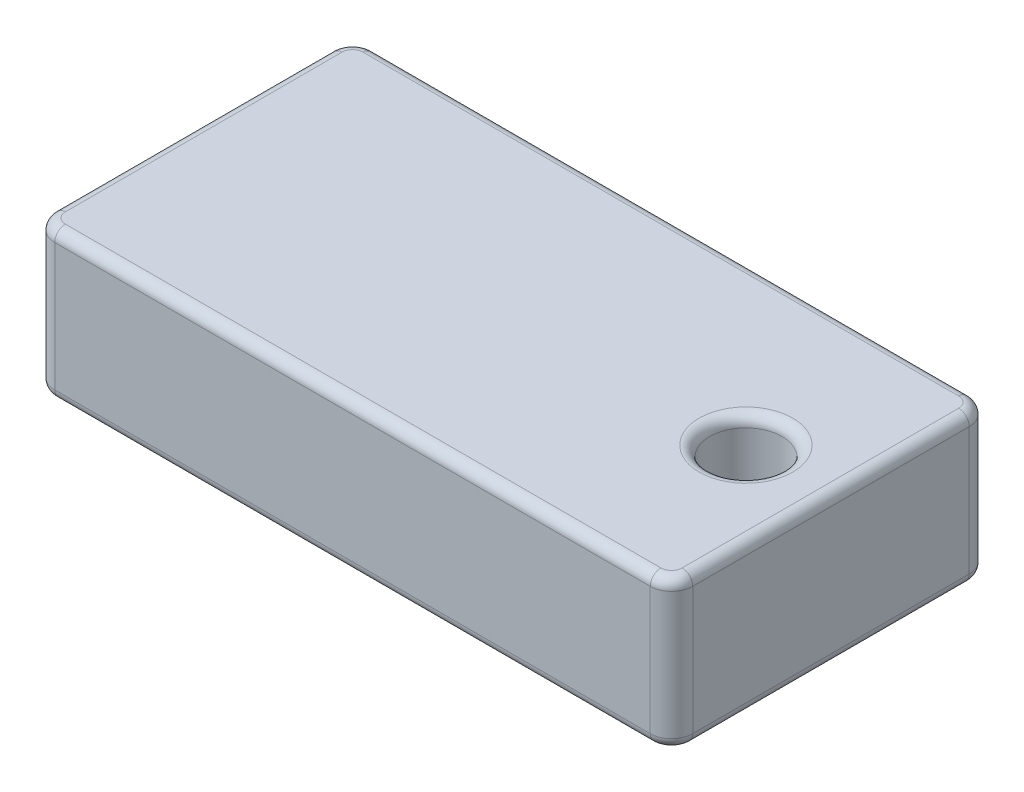
from build123d import *

# Parameters (mm, degrees)
SKETCH_1_W          = 30
SKETCH_1_H          = 15
EXTRUDE_1_DEPTH     = 7
HOLE_WIZARD_M3_1_D  = 3.4
FILLET_1_R          = 1
FILLET_2_R          = 0.5
SKETCH_4_W          = 4.766027623
SKETCH_4_H          = 0.404956595
CUT_EXTRUDE_1_DEPTH = 3


with BuildPart() as part:
    # 草图1 → 凸台-拉伸1 (new body)
    with BuildSketch(Plane(origin=(0, 0, 0), x_dir=(1, 0, 0), z_dir=(0, 1, 0))):
        Rectangle(SKETCH_1_W, SKETCH_1_H)
    extrude(amount=EXTRUDE_1_DEPTH)

    # M3 间隙孔1 (through all)
    with Locations(Plane(origin=(0, 7, 0), x_dir=(1, 0, 0), z_dir=(0, 1, 0))):
        with Locations((11, 0)):
            Hole(HOLE_WIZARD_M3_1_D / 2)

    # 圆角1
    fillet_1_edges = [part.edges().sort_by_distance(p)[0] for p in [
        (-15, 3.5, -7.5),
        (15, 3.5, -7.5),
        (15, 3.5, 7.5),
        (-15, 3.5, 7.5),
    ]]
    fillet(fillet_1_edges, radius=FILLET_1_R)

    # 圆角2
    fillet_2_edges = [part.edges().sort_by_distance(p)[0] for p in [
        (-14.707106781, 0, 7.207106781),
        (0, 0, 7.5),
        (14.707106781, 0, 7.207106781),
        (15, 0, 0),
        (14.707106781, 0, -7.207106781),
        (0, 0, -7.5),
        (-14.707106781, 0, -7.207106781),
        (-15, 0, 0),
        (12.7, 0, 0),
        (14.707106781, 7, -7.207106781),
        (15, 7, 0),
        (14.707106781, 7, 7.207106781),
        (0, 7, 7.5),
        (-14.707106781, 7, 7.207106781),
        (-15, 7, 0),
        (-14.707106781, 7, -7.207106781),
        (0, 7, -7.5),
        (12.7, 7, 0),
    ]]
    fillet(fillet_2_edges, radius=FILLET_2_R)

    # 草图4 → 切除-拉伸1 (cut)
    with BuildSketch(Plane(origin=(0, 0, -7.5), x_dir=(-1, 0, 0), z_dir=(0, 0, -1))):
        with Locations((9.765684052, 5.616519295)):
            Rectangle(SKETCH_4_W, SKETCH_4_H)
    extrude(amount=-CUT_EXTRUDE_1_DEPTH, mode=Mode.SUBTRACT)


solid = part.part
